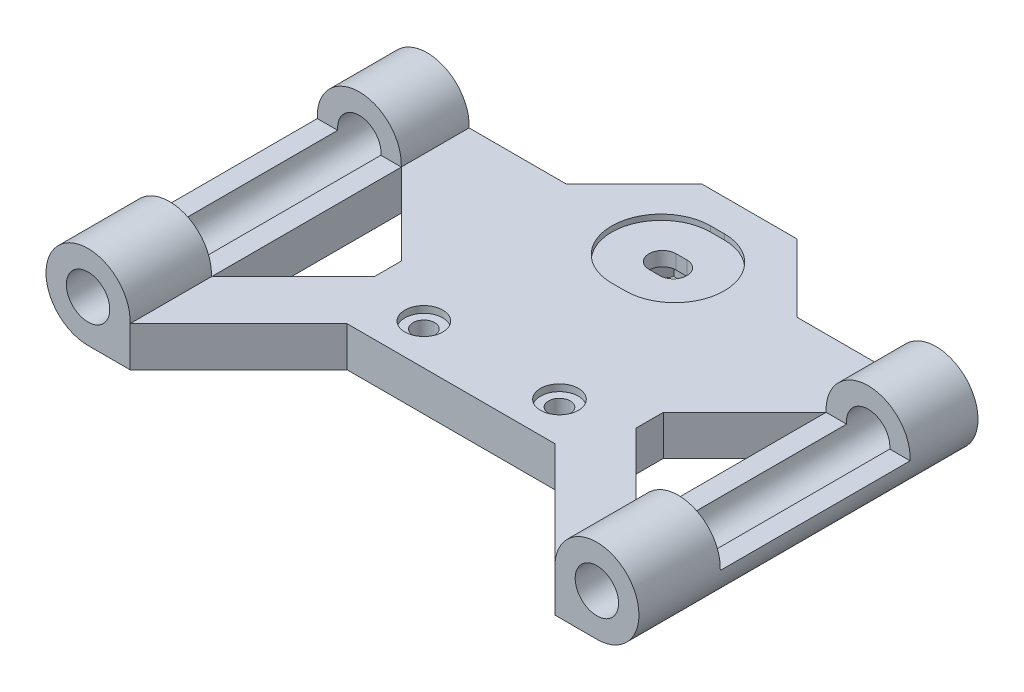
from build123d import *

# Parameters (mm, degrees)
SKETCH_1_R             = 3.1
SKETCH_1_R_2           = 1.6
EXTRUDE_1_DEPTH        = 25
EXTRUDE_2_DEPTH        = 2.945
CUT_EXTRUDE_1_DEPTH    = 56.64644355
CUT_EXTRUDE_START      = -1.5
CUT_EXTRUDE_2844_DEPTH = 1.5
SKETCH_6_R             = 0.8
CUT_EXTRUDE_5_DEPTH    = 56.64644355
CUT_EXTRUDE_6_DEPTH    = 56.64644355
SKETCH_9_W             = 14
SKETCH_9_H             = 3.255
CUT_EXTRUDE_9_DEPTH    = 46.904396246
SKETCH_10_R            = 1.4
CUT_EXTRUDE_11_DEPTH   = 0.5
CUT_EXTRUDE_12_DEPTH   = 0.4


# Read off the part's stored shape, not the designer's step: 切除-螺母孔
with BuildPart() as part:
    # 草图1 → 凸台-拉伸1 (new body)
    # profile 1 of 3: a face of its own
    with BuildSketch(Plane.XY):
        with Locations((-46.507778168, 5.529205914)):
            Circle(SKETCH_1_R)
        with Locations((-46.507778168, 5.529205914)):
            Circle(SKETCH_1_R_2, mode=Mode.SUBTRACT)
    # profile 2 of 3: a face of its own
    with BuildSketch(Plane.XY):
        with BuildLine():
            ThreePointArc((-43.411655593, 5.374205914), (-44.371250611, 3.283042519), (-46.507778168, 2.429205914))
            Line((-46.507778168, 2.429205914), (-8.987778168, 2.429205914))
            ThreePointArc((-8.987778168, 2.429205914), (-11.124305724, 3.283042519), (-12.083900743, 5.374205914))
            Line((-12.083900743, 5.374205914), (-43.411655593, 5.374205914))
        make_face()
    # profile 3 of 3: a face of its own
    with BuildSketch(Plane.XY):
        with Locations((-8.987778168, 5.529205914)):
            Circle(SKETCH_1_R)
        with Locations((-8.987778168, 5.529205914)):
            Circle(SKETCH_1_R_2, mode=Mode.SUBTRACT)
    extrude(amount=EXTRUDE_1_DEPTH)

    # 草图2 → 凸台-拉伸2 (add)
    with BuildSketch(Plane(origin=(0, 5.374205914, 0), x_dir=(1, 0, 0), z_dir=(0, 1, 0))):
        Polygon((-19.247778168, 0), (-24.247778168, 5), (-31.247778168, 5), (-36.247778168, 0), align=None)
    extrude(amount=-EXTRUDE_2_DEPTH)

    # 草图3 → 切除-拉伸1 (cut, through all)
    with BuildSketch(Plane(origin=(0, 5.374205914, 0), x_dir=(1, 0, 0), z_dir=(0, 1, 0))):
        with BuildLine():
            Line((-28.147778168, 0), (-27.347778168, 0))
            ThreePointArc((-27.347778168, 0), (-26.347778168, -1), (-27.347778168, -2))
            Line((-27.347778168, -2), (-28.147778168, -2))
            ThreePointArc((-28.147778168, -2), (-29.147778168, -1), (-28.147778168, 0))
        make_face()
    extrude(amount=-CUT_EXTRUDE_1_DEPTH, mode=Mode.SUBTRACT)

    # Cut-Extrude 2844 outline → Cut-Extrude 2844 (cut)
    with BuildSketch(Plane(origin=(0, 2.429205914, 0), x_dir=(-1, 0, 0), z_dir=(0, -1, 0)).offset(CUT_EXTRUDE_START)):
        Polygon((25.038377091, -1), (26.193077629, -3), (29.302478706, -3), (30.457179245, -1), (29.302478706, 1), (26.193077629, 1), align=None)
        with BuildLine():
            Line((27.347778168, 0), (28.147778168, 0))
            ThreePointArc((28.147778168, 0), (29.147778168, -1), (28.147778168, -2))
            Line((28.147778168, -2), (27.347778168, -2))
            ThreePointArc((27.347778168, -2), (26.347778168, -1), (27.347778168, 0))
        make_face(mode=Mode.SUBTRACT)
    extrude(amount=CUT_EXTRUDE_2844_DEPTH, mode=Mode.SUBTRACT)

    # 草图6 → 切除-拉伸5 (cut, through all)
    with BuildSketch(Plane(origin=(0, 5.374205914, 0), x_dir=(1, 0, 0), z_dir=(0, 1, 0))):
        with Locations(Location((-32.747778168, -14, 0), (0, 0, 270))):
            Circle(SKETCH_6_R)
        with Locations(Location((-22.747778168, -14, 0), (0, 0, 270))):
            Circle(SKETCH_6_R)
    extrude(amount=-CUT_EXTRUDE_5_DEPTH, mode=Mode.SUBTRACT)

    # 草图7 → 切除-拉伸6 (cut, through all)
    with BuildSketch(Plane(origin=(0, 5.374205914, 0), x_dir=(1, 0, 0), z_dir=(0, 1, 0))):
        Polygon((-35.407778168, -17), (-43.407778168, -25), (-12.083900743, -25), (-20.083900743, -17), align=None)
        Polygon((-37.407778168, -13), (-37.407778168, -11), (-43.407778168, -5), (-43.407778168, -19), align=None)
        Polygon((-12.087778168, -5), (-18.087778168, -11), (-18.087778168, -13), (-12.087778168, -19), align=None)
    extrude(amount=-CUT_EXTRUDE_6_DEPTH, mode=Mode.SUBTRACT)

    # 草图9 → 切除-拉伸9 (cut, through all)
    with BuildSketch(Plane.ZY.offset(12.087778168)):
        with Locations((12, 7.001705914)):
            Rectangle(SKETCH_9_W, SKETCH_9_H)
    cut_extrude_9 = extrude(amount=-CUT_EXTRUDE_9_DEPTH, mode=Mode.SUBTRACT)

    # 镜向1: 切除-拉伸9 across plane
    add(cut_extrude_9.mirror(Plane(origin=(-27.747778168, 0, 0), x_dir=(0, 0, 1), z_dir=(1, 0, 0))), mode=Mode.SUBTRACT)

    # 草图10 → 切除-拉伸11 (cut)
    with BuildSketch(Plane(origin=(0, 5.374205914, 0), x_dir=(1, 0, 0), z_dir=(0, 1, 0))):
        with Locations(Location((-22.747778168, -14, 0), (0, 0, 270))):
            Circle(SKETCH_10_R)
        with Locations(Location((-32.747778168, -14, 0), (0, 0, 270))):
            Circle(SKETCH_10_R)
    extrude(amount=-CUT_EXTRUDE_11_DEPTH, mode=Mode.SUBTRACT)

    # 草图11 → 切除-拉伸12 (cut)
    with BuildSketch(Plane(origin=(0, 5.374205914, 0), x_dir=(1, 0, 0), z_dir=(0, 1, 0))):
        with BuildLine():
            Line((-27.247778168, -4.65), (-28.247778168, -4.65))
            ThreePointArc((-28.247778168, -4.65), (-31.897778168, -1), (-28.247778168, 2.65))
            Line((-28.247778168, 2.65), (-27.247778168, 2.65))
            ThreePointArc((-27.247778168, 2.65), (-23.597778168, -1), (-27.247778168, -4.65))
        make_face()
    extrude(amount=-CUT_EXTRUDE_12_DEPTH, mode=Mode.SUBTRACT)


solid = part.part
